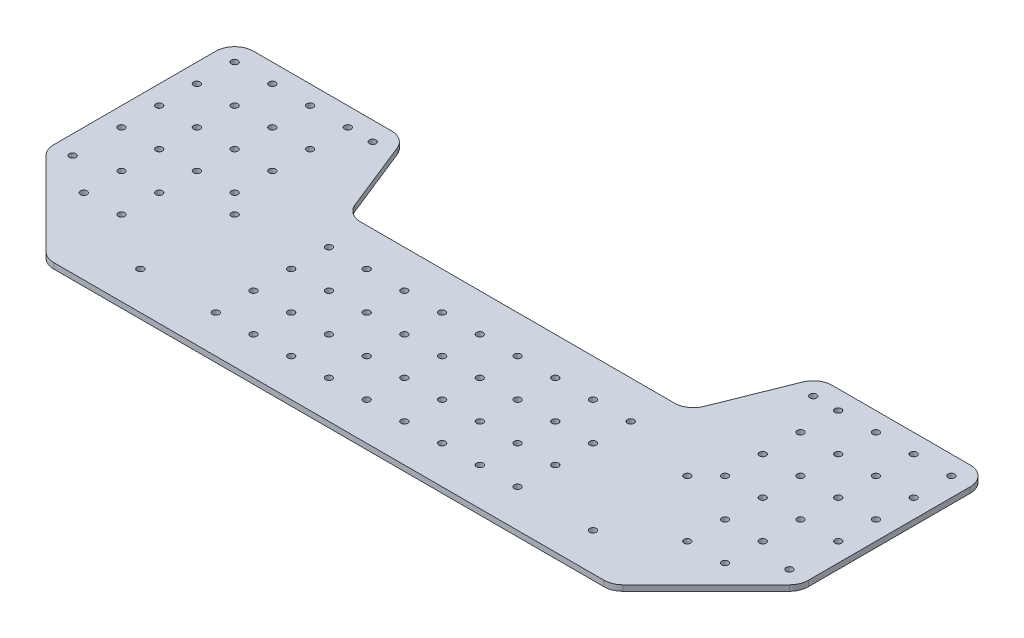
from build123d import *

# Parameters (mm, degrees)
EXTRUDE_1_DEPTH     = 3
SKETCH_2_R          = 1.75
CUT_EXTRUDE_1_DEPTH = 59
SKETCH_3_R          = 1.75
CUT_EXTRUDE_2_DEPTH = 59
SKETCH_5_R          = 1.75
CUT_EXTRUDE_4_DEPTH = 10
SKETCH_6_R          = 1.75
CUT_EXTRUDE_5_DEPTH = 10
SKETCH_7_R          = 1.75
CUT_EXTRUDE_6_DEPTH = 10


with BuildPart() as part:
    # 草图1 → 凸台-拉伸1 (new body)
    with BuildSketch(Plane(origin=(0, 0, 0), x_dir=(1, 0, 0), z_dir=(0, 1, 0))):
        with BuildLine():
            Line((-197.071067812, -27.928932188), (-152.928932188, -72.071067812))
            ThreePointArc((-152.928932188, -72.071067812), (-149.6846987, -74.238795325), (-145.857864376, -75))
            Line((-145.857864376, -75), (145.857864376, -75))
            ThreePointArc((145.857864376, -75), (149.6846987, -74.238795325), (152.928932188, -72.071067812))
            Line((152.928932188, -72.071067812), (197.071067812, -27.928932188))
            ThreePointArc((197.071067812, -27.928932188), (199.238795325, -24.6846987), (200, -20.857864376))
            Line((200, -20.857864376), (200, 65))
            ThreePointArc((200, 65), (197.071067812, 72.071067812), (190, 75))
            Line((190, 75), (116.770329614, 75))
            ThreePointArc((116.770329614, 75), (111.164041521, 73.280672305), (107.485562705, 68.713906764))
            Line((107.485562705, 68.713906764), (92.514437295, 31.286093236))
            ThreePointArc((92.514437295, 31.286093236), (88.835958479, 26.719327695), (83.229670386, 25))
            Line((83.229670386, 25), (-83.229670386, 25))
            ThreePointArc((-83.229670386, 25), (-88.835958479, 26.719327695), (-92.514437295, 31.286093236))
            Line((-92.514437295, 31.286093236), (-107.485562705, 68.713906764))
            ThreePointArc((-107.485562705, 68.713906764), (-111.164041521, 73.280672305), (-116.770329614, 75))
            Line((-116.770329614, 75), (-190, 75))
            ThreePointArc((-190, 75), (-197.071067812, 72.071067812), (-200, 65))
            Line((-200, 65), (-200, -20.857864376))
            ThreePointArc((-200, -20.857864376), (-199.238795325, -24.6846987), (-197.071067812, -27.928932188))
        make_face()
    extrude(amount=EXTRUDE_1_DEPTH)

    # 草图2 → 切除-拉伸1 (cut)
    with BuildSketch(Plane.XZ):
        with Locations((120, 5)):
            Circle(SKETCH_2_R)
        with Locations((120, 55)):
            Circle(SKETCH_2_R)
        with Locations((-120, 55)):
            Circle(SKETCH_2_R)
        with Locations((-120, 5)):
            Circle(SKETCH_2_R)
    extrude(amount=-CUT_EXTRUDE_1_DEPTH, mode=Mode.SUBTRACT)

    # 草图3 → 切除-拉伸2 (cut)
    with BuildSketch(Plane(origin=(0, 3, 0), x_dir=(1, 0, 0), z_dir=(0, 1, 0))):
        with Locations((116.770329614, 65)):
            Circle(SKETCH_3_R)
        with Locations((190, 65)):
            Circle(SKETCH_3_R)
        with Locations((-190, 65)):
            Circle(SKETCH_3_R)
        with Locations((-116.770329614, 65)):
            Circle(SKETCH_3_R)
        with Locations((-190, -20.857864376)):
            Circle(SKETCH_3_R)
        with Locations((190, -20.857864376)):
            Circle(SKETCH_3_R)
    extrude(amount=-CUT_EXTRUDE_2_DEPTH, mode=Mode.SUBTRACT)

    # 草图5 → 切除-拉伸4 (cut)
    with BuildSketch(Plane(origin=(0, 3, 0), x_dir=(1, 0, 0), z_dir=(0, 1, 0))):
        with Locations((-20, 5)):
            Circle(SKETCH_5_R)
        with Locations((-20, -15)):
            Circle(SKETCH_5_R)
        with Locations((-20, -35)):
            Circle(SKETCH_5_R)
        with Locations((-20, -55)):
            Circle(SKETCH_5_R)
        with Locations((-40, 5)):
            Circle(SKETCH_5_R)
        with Locations((-40, -15)):
            Circle(SKETCH_5_R)
        with Locations((-40, -35)):
            Circle(SKETCH_5_R)
        with Locations((-40, -55)):
            Circle(SKETCH_5_R)
        with Locations((-60, 5)):
            Circle(SKETCH_5_R)
        with Locations((-60, -15)):
            Circle(SKETCH_5_R)
        with Locations((-60, -35)):
            Circle(SKETCH_5_R)
        with Locations((-60, -55)):
            Circle(SKETCH_5_R)
        with Locations((-80, 5)):
            Circle(SKETCH_5_R)
        with Locations((-80, -15)):
            Circle(SKETCH_5_R)
        with Locations((-80, -35)):
            Circle(SKETCH_5_R)
        with Locations((-80, -55)):
            Circle(SKETCH_5_R)
        with Locations((80, -55)):
            Circle(SKETCH_5_R)
        with Locations((80, -35)):
            Circle(SKETCH_5_R)
        with Locations((80, -15)):
            Circle(SKETCH_5_R)
        with Locations((80, 5)):
            Circle(SKETCH_5_R)
        with Locations((60, -55)):
            Circle(SKETCH_5_R)
        with Locations((60, -35)):
            Circle(SKETCH_5_R)
        with Locations((60, -15)):
            Circle(SKETCH_5_R)
        with Locations((60, 5)):
            Circle(SKETCH_5_R)
        with Locations((40, -55)):
            Circle(SKETCH_5_R)
        with Locations((40, -35)):
            Circle(SKETCH_5_R)
        with Locations((40, -15)):
            Circle(SKETCH_5_R)
        with Locations((40, 5)):
            Circle(SKETCH_5_R)
        with Locations((20, -55)):
            Circle(SKETCH_5_R)
        with Locations((20, -35)):
            Circle(SKETCH_5_R)
        with Locations((20, -15)):
            Circle(SKETCH_5_R)
        with Locations((20, 5)):
            Circle(SKETCH_5_R)
    extrude(amount=-CUT_EXTRUDE_4_DEPTH, mode=Mode.SUBTRACT)

    # 草图6 → 切除-拉伸5 (cut)
    with BuildSketch(Plane(origin=(0, 3, 0), x_dir=(1, 0, 0), z_dir=(0, 1, 0))):
        with Locations((-170, 65)):
            Circle(SKETCH_6_R)
        with Locations((-150, 65)):
            Circle(SKETCH_6_R)
        with Locations((-130, 65)):
            Circle(SKETCH_6_R)
        with Locations((-190, 45)):
            Circle(SKETCH_6_R)
        with Locations((-170, 45)):
            Circle(SKETCH_6_R)
        with Locations((-150, 45)):
            Circle(SKETCH_6_R)
        with Locations((-130, 45)):
            Circle(SKETCH_6_R)
        with Locations((-190, 25)):
            Circle(SKETCH_6_R)
        with Locations((-170, 25)):
            Circle(SKETCH_6_R)
        with Locations((-150, 25)):
            Circle(SKETCH_6_R)
        with Locations((-130, 25)):
            Circle(SKETCH_6_R)
        with Locations((-190, 5)):
            Circle(SKETCH_6_R)
        with Locations((-170, 5)):
            Circle(SKETCH_6_R)
        with Locations((-150, 5)):
            Circle(SKETCH_6_R)
        with Locations((-130, 5)):
            Circle(SKETCH_6_R)
        with Locations((-170, -15)):
            Circle(SKETCH_6_R)
        with Locations((-150, -15)):
            Circle(SKETCH_6_R)
        with Locations((-170, -35)):
            Circle(SKETCH_6_R)
        with Locations((-150, -35)):
            Circle(SKETCH_6_R)
        with Locations((150, -35)):
            Circle(SKETCH_6_R)
        with Locations((170, -35)):
            Circle(SKETCH_6_R)
        with Locations((150, -15)):
            Circle(SKETCH_6_R)
        with Locations((170, -15)):
            Circle(SKETCH_6_R)
        with Locations((130, 5)):
            Circle(SKETCH_6_R)
        with Locations((150, 5)):
            Circle(SKETCH_6_R)
        with Locations((170, 5)):
            Circle(SKETCH_6_R)
        with Locations((190, 5)):
            Circle(SKETCH_6_R)
        with Locations((130, 25)):
            Circle(SKETCH_6_R)
        with Locations((150, 25)):
            Circle(SKETCH_6_R)
        with Locations((170, 25)):
            Circle(SKETCH_6_R)
        with Locations((190, 25)):
            Circle(SKETCH_6_R)
        with Locations((130, 45)):
            Circle(SKETCH_6_R)
        with Locations((150, 45)):
            Circle(SKETCH_6_R)
        with Locations((170, 45)):
            Circle(SKETCH_6_R)
        with Locations((190, 45)):
            Circle(SKETCH_6_R)
        with Locations((130, 65)):
            Circle(SKETCH_6_R)
        with Locations((150, 65)):
            Circle(SKETCH_6_R)
        with Locations((170, 65)):
            Circle(SKETCH_6_R)
    extrude(amount=-CUT_EXTRUDE_5_DEPTH, mode=Mode.SUBTRACT)

    # 草图7 → 切除-拉伸6 (cut)
    with BuildSketch(Plane(origin=(0, 3, 0), x_dir=(1, 0, 0), z_dir=(0, 1, 0))):
        with Locations((0, 5)):
            Circle(SKETCH_7_R)
        with Locations((0, -15)):
            Circle(SKETCH_7_R)
        with Locations((0, -35)):
            Circle(SKETCH_7_R)
        with Locations((0, -55)):
            Circle(SKETCH_7_R)
    extrude(amount=-CUT_EXTRUDE_6_DEPTH, mode=Mode.SUBTRACT)


solid = part.part
